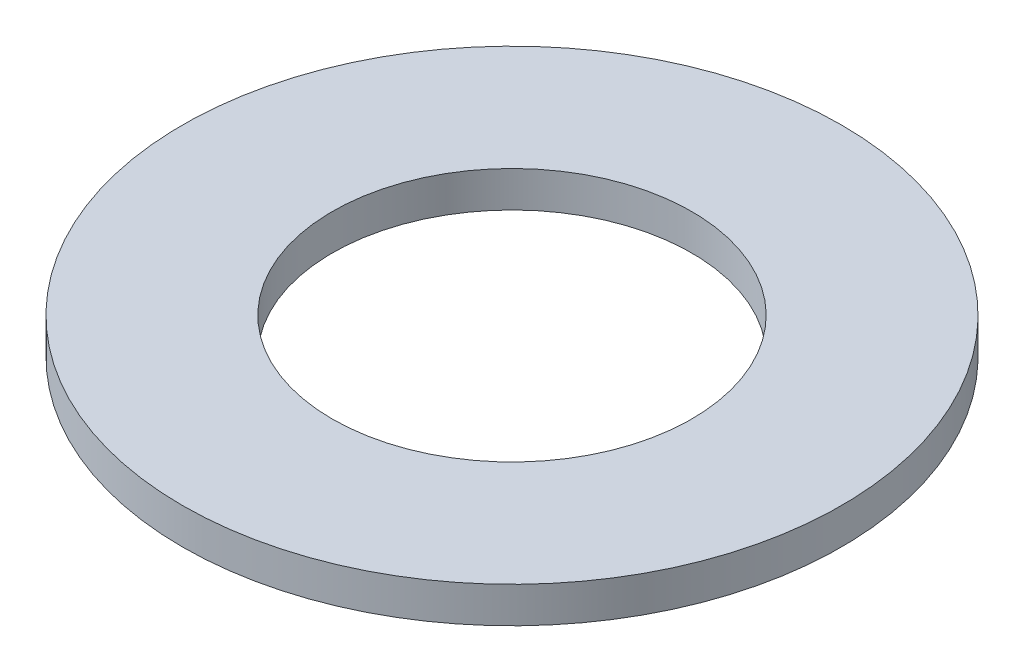
from build123d import *

# Parameters (mm, degrees)
ESQUISSE1_R        = 5.5
ESQUISSE1_R_2      = 3
BOSS_EXTRU_1_DEPTH = 0.6


with BuildPart() as part:
    # Esquisse1 → Boss.-Extru.1 (new body)
    with BuildSketch(Plane(origin=(0, 0, 0), x_dir=(1, 0, 0), z_dir=(0, 1, 0))):
        Circle(ESQUISSE1_R)
        Circle(ESQUISSE1_R_2, mode=Mode.SUBTRACT)
    extrude(amount=BOSS_EXTRU_1_DEPTH)


solid = part.part
